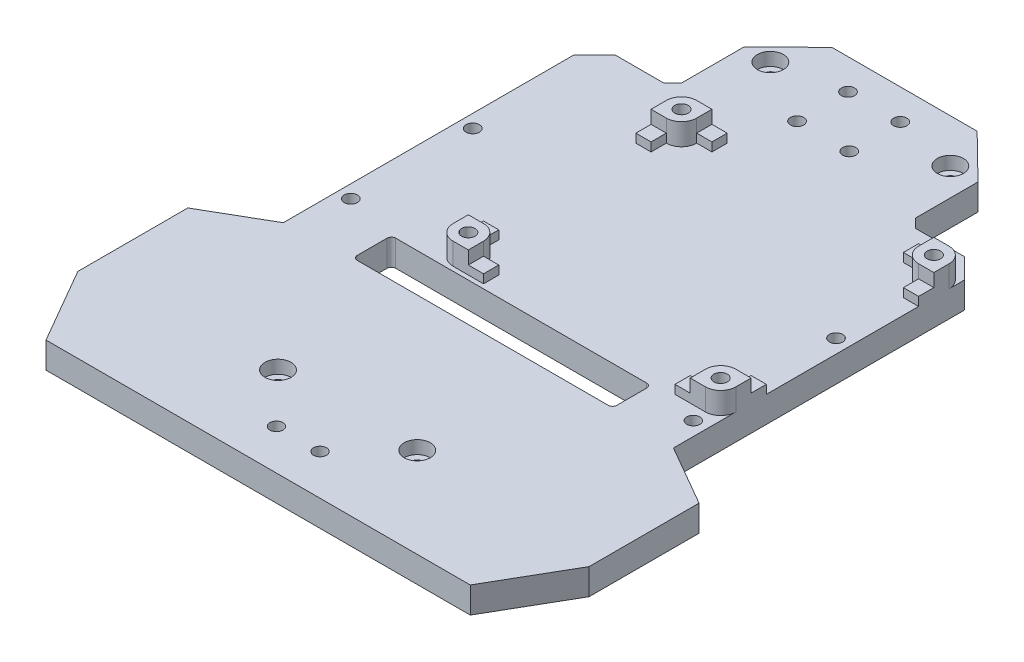
from build123d import *

# Parameters (mm, degrees)
BOSS_EXTRUDE1_DEPTH     = 6
SKETCH2_R               = 1.525
CUT_EXTRUDE1_DEPTH      = 7
SKETCH3_R               = 3
CUT_EXTRUDE2_DEPTH      = 3
SKETCH4_W               = 65
SKETCH4_H               = 56
SKETCH4_R               = 1.55
BOSS_EXTRUDE3_DEPTH     = 2
FILLET1_R               = 3.5
CUT_EXTRUDE3_DEPTH      = 100.052214883
CUT_EXTRUDE3_DEPTH_BACK = 100.052214883
SKETCH5_W               = 35
SKETCH5_H               = 2
CUT_EXTRUDE4_DEPTH      = 88.043057368
CUT_EXTRUDE4_DEPTH_BACK = 88.043057368
SKETCH4_2_R             = 1.55
CUT_EXTRUDE5_DEPTH      = 99.337435643
CUT_EXTRUDE5_DEPTH_BACK = 99.337435643
SKETCH6_W               = 44
SKETCH6_H               = 2
SKETCH8_R               = 1.55
BOSS_EXTRUDE4_DEPTH     = 3
SKETCH9_R               = 1.525
CUT_EXTRUDE6_DEPTH      = 10
SKETCH10_R              = 1.525
SKETCH10_R_2            = 1.5
CUT_EXTRUDE7_DEPTH      = 88.043057368
SKETCH11_R              = 1.5
CUT_EXTRUDE8_DEPTH      = 88.043057368
BOSS_EXTRUDE5_DEPTH     = 6
CHAMFER1_SIZE           = 10
CHAMFER1_SIZE2          = 17.320508076
CHAMFER2_SIZE           = 10
CHAMFER2_SIZE_2         = 17.320508076
SKETCH13_W              = 59.682055882
SKETCH13_H              = 8.847332747
CUT_EXTRUDE9_DEPTH      = 95.976880568
FILLET2_R               = 1


with BuildPart() as part:
    # Sketch1 → Boss-Extrude1 (new body)
    with BuildSketch(Plane(origin=(0, 0, 0), x_dir=(1, 0, 0), z_dir=(0, 1, 0))):
        Polygon((-16.600550214, 74.267677554), (-26.800550214, 64.267542947), (-26.800550214, 54.267542947), (-26.800550214, 49.870959834), (-28.827161805, 47.844348244), (-40.071838845, 47.844348244), (-44.758202946, 43.157984143), (-44.758202946, 18.06842534), (-44.758202946, -12.842015857), (-44.758202946, -32.251429112), (-40.117175005, -36.892457053), (-40.117175005, -74.312457053), (0.082824995, -74.312457053), (40.282824995, -74.312457053), (40.282824995, -36.892457053), (44.923852936, -32.251429112), (44.923852936, -12.842015857), (44.923852936, 18.06842534), (44.923852936, 43.157984143), (40.237488836, 47.844348244), (28.992811796, 47.844348244), (26.966200205, 49.870959834), (26.966200205, 54.267542947), (26.966200205, 64.267542947), (16.766200205, 74.267677554), (0.082824995, 74.267677554), align=None)
    extrude(amount=BOSS_EXTRUDE1_DEPTH)

    # Sketch2 → Cut-Extrude1 (cut)
    with BuildSketch(Plane(origin=(0, 6, 0), x_dir=(1, 0, 0), z_dir=(0, 1, 0))):
        with Locations(Location((-20.760550214, 64.267542947, 0), (0, 0, 270))):
            Circle(SKETCH2_R)
        with Locations(Location((20.606200205, 64.267542947, 0), (0, 0, 270))):
            Circle(SKETCH2_R)
        with Locations(Location((-16.077175005, -53.582457053, 0), (0, 0, 270))):
            Circle(SKETCH2_R)
        with Locations(Location((15.922824995, -53.582457053, 0), (0, 0, 270))):
            Circle(SKETCH2_R)
    extrude(amount=-CUT_EXTRUDE1_DEPTH, mode=Mode.SUBTRACT)

    # Sketch3 → Cut-Extrude2 (cut)
    with BuildSketch(Plane(origin=(0, 6, 0), x_dir=(1, 0, 0), z_dir=(0, 1, 0))):
        with Locations(Location((-20.760550214, 64.267542947, 0), (0, 0, 270))):
            Circle(SKETCH3_R)
        with Locations(Location((20.606200205, 64.267542947, 0), (0, 0, 270))):
            Circle(SKETCH3_R)
        with Locations(Location((-16.077175005, -53.582457053, 0), (0, 0, 270))):
            Circle(SKETCH3_R)
        with Locations(Location((15.922824995, -53.582457053, 0), (0, 0, 270))):
            Circle(SKETCH3_R)
    extrude(amount=-CUT_EXTRUDE2_DEPTH, mode=Mode.SUBTRACT)

    # Sketch4 → Boss-Extrude3 (add)
    with BuildSketch(Plane(origin=(0, 6, 0), x_dir=(1, 0, 0), z_dir=(0, 1, 0))):
        with Locations((12.423852936, 15.157984143)):
            Rectangle(SKETCH4_W, SKETCH4_H)
        with Locations(Location((-16.576147064, 39.657984143, 0), (0, 0, 270))):
            Circle(SKETCH4_R, mode=Mode.SUBTRACT)
        with Locations(Location((41.423852936, 39.657984143, 0), (0, 0, 270))):
            Circle(SKETCH4_R, mode=Mode.SUBTRACT)
        with Locations(Location((41.423852936, -9.342015857, 0), (0, 0, 270))):
            Circle(SKETCH4_R, mode=Mode.SUBTRACT)
        with Locations(Location((-16.576147064, -9.342015857, 0), (0, 0, 270))):
            Circle(SKETCH4_R, mode=Mode.SUBTRACT)
        with BuildLine():
            Line((41.423852936, 36.157984143), (41.423852936, -5.842015857))
            ThreePointArc((41.423852936, -5.842015857), (38.948979202, -6.867142122), (37.923852936, -9.342015857))
            Line((37.923852936, -9.342015857), (-13.076147064, -9.342015857))
            ThreePointArc((-13.076147064, -9.342015857), (-14.101273329, -6.867142122), (-16.576147064, -5.842015857))
            Line((-16.576147064, -5.842015857), (-16.576147064, 36.157984143))
            ThreePointArc((-16.576147064, 36.157984143), (-14.101273329, 37.183110409), (-13.076147064, 39.657984143))
            Line((-13.076147064, 39.657984143), (37.923852936, 39.657984143))
            ThreePointArc((37.923852936, 39.657984143), (38.948979202, 37.183110409), (41.423852936, 36.157984143))
        make_face(mode=Mode.SUBTRACT)
    extrude(amount=BOSS_EXTRUDE3_DEPTH)

    # Fillet1
    fillet1_edges = [part.edges().sort_by_distance(p)[0] for p in [
        (-20.076147064, 7, -43.157984143),
        (-20.076147064, 7, 12.842015857),
        (44.923852936, 7, 12.842015857),
        (44.923852936, 7, -43.157984143),
    ]]
    fillet(fillet1_edges, radius=FILLET1_R)

    # Sketch5 → Cut-Extrude3 (cut, two sides: drawn at the far end of the back side and taken through both)
    with BuildSketch(Plane.ZY.offset(20.076147064).offset(-CUT_EXTRUDE3_DEPTH_BACK)):
        with Locations((-15.157984143, 7)):
            Rectangle(SKETCH5_W, SKETCH5_H)
    extrude(amount=CUT_EXTRUDE3_DEPTH + CUT_EXTRUDE3_DEPTH_BACK, mode=Mode.SUBTRACT)

    # Sketch4<2> → Cut-Extrude4 (cut, two sides: drawn at the far end of the back side and taken through both)
    with BuildSketch(Plane(origin=(0, 6, 0), x_dir=(1, 0, 0), z_dir=(0, 1, 0)).offset(-CUT_EXTRUDE4_DEPTH_BACK)):
        with Locations(Location((-16.576147064, 39.657984143, 0), (0, 0, 270))):
            Circle(SKETCH4_2_R)
        with Locations(Location((41.423852936, 39.657984143, 0), (0, 0, 270))):
            Circle(SKETCH4_2_R)
        with Locations(Location((41.423852936, -9.342015857, 0), (0, 0, 270))):
            Circle(SKETCH4_2_R)
        with Locations(Location((-16.576147064, -9.342015857, 0), (0, 0, 270))):
            Circle(SKETCH4_2_R)
    extrude(amount=CUT_EXTRUDE4_DEPTH + CUT_EXTRUDE4_DEPTH_BACK, mode=Mode.SUBTRACT)

    # Sketch6 → Cut-Extrude5 (cut, two sides: drawn at the far end of the back side and taken through both)
    with BuildSketch(Plane.XY.offset(12.842015857).offset(-CUT_EXTRUDE5_DEPTH_BACK)):
        with Locations((12.423852936, 7)):
            Rectangle(SKETCH6_W, SKETCH6_H)
    extrude(amount=CUT_EXTRUDE5_DEPTH + CUT_EXTRUDE5_DEPTH_BACK, mode=Mode.SUBTRACT)

    # Sketch8 → Boss-Extrude4 (add)
    # profile 1 of 4: a face of its own
    with BuildSketch(Plane(origin=(0, 8, 0), x_dir=(1, 0, 0), z_dir=(0, 1, 0))):
        with BuildLine():
            Line((-13.076147064, -9.342015857), (-13.076147064, -12.842015857))
            Line((-13.076147064, -12.842015857), (-16.576147064, -12.842015857))
            ThreePointArc((-16.576147064, -12.842015857), (-19.051020798, -11.816889591), (-20.076147064, -9.342015857))
            Line((-20.076147064, -9.342015857), (-20.076147064, -5.842015857))
            Line((-20.076147064, -5.842015857), (-16.576147064, -5.842015857))
            ThreePointArc((-16.576147064, -5.842015857), (-14.101273329, -6.867142122), (-13.076147064, -9.342015857))
        make_face()
        with Locations(Location((-16.576147064, -9.342015857, 0), (0, 0, 270))):
            Circle(SKETCH8_R, mode=Mode.SUBTRACT)
    # profile 2 of 4: a face of its own
    with BuildSketch(Plane(origin=(0, 8, 0), x_dir=(1, 0, 0), z_dir=(0, 1, 0))):
        with BuildLine():
            Line((41.423852936, -12.842015857), (37.923852936, -12.842015857))
            Line((37.923852936, -12.842015857), (37.923852936, -9.342015857))
            ThreePointArc((37.923852936, -9.342015857), (38.948979202, -6.867142122), (41.423852936, -5.842015857))
            Line((41.423852936, -5.842015857), (44.923852936, -5.842015857))
            Line((44.923852936, -5.842015857), (44.923852936, -9.342015857))
            ThreePointArc((44.923852936, -9.342015857), (43.898726671, -11.816889591), (41.423852936, -12.842015857))
        make_face()
        with Locations(Location((41.423852936, -9.342015857, 0), (0, 0, 270))):
            Circle(SKETCH8_R, mode=Mode.SUBTRACT)
    # profile 3 of 4: a face of its own
    with BuildSketch(Plane(origin=(0, 8, 0), x_dir=(1, 0, 0), z_dir=(0, 1, 0))):
        with BuildLine():
            Line((-16.576147064, 43.157984143), (-13.076147064, 43.157984143))
            Line((-13.076147064, 43.157984143), (-13.076147064, 39.657984143))
            ThreePointArc((-13.076147064, 39.657984143), (-14.101273329, 37.183110409), (-16.576147064, 36.157984143))
            Line((-16.576147064, 36.157984143), (-20.076147064, 36.157984143))
            Line((-20.076147064, 36.157984143), (-20.076147064, 39.657984143))
            ThreePointArc((-20.076147064, 39.657984143), (-19.051020798, 42.132857878), (-16.576147064, 43.157984143))
        make_face()
        with Locations(Location((-16.576147064, 39.657984143, 0), (0, 0, 270))):
            Circle(SKETCH8_R, mode=Mode.SUBTRACT)
    # profile 4 of 4: a face of its own
    with BuildSketch(Plane(origin=(0, 8, 0), x_dir=(1, 0, 0), z_dir=(0, 1, 0))):
        with BuildLine():
            Line((37.923852936, 39.657984143), (37.923852936, 43.157984143))
            Line((37.923852936, 43.157984143), (41.423852936, 43.157984143))
            ThreePointArc((41.423852936, 43.157984143), (43.898726671, 42.132857878), (44.923852936, 39.657984143))
            Line((44.923852936, 39.657984143), (44.923852936, 36.157984143))
            Line((44.923852936, 36.157984143), (41.423852936, 36.157984143))
            ThreePointArc((41.423852936, 36.157984143), (38.948979202, 37.183110409), (37.923852936, 39.657984143))
        make_face()
        with Locations(Location((41.423852936, 39.657984143, 0), (0, 0, 270))):
            Circle(SKETCH8_R, mode=Mode.SUBTRACT)
    extrude(amount=BOSS_EXTRUDE4_DEPTH)

    # Sketch9 → Cut-Extrude6 (cut)
    with BuildSketch(Plane(origin=(0, 6, 0), x_dir=(1, 0, 0), z_dir=(0, 1, 0))):
        with Locations(Location((-5.917175005, 67.267677554, 0), (0, 0, 270))):
            Circle(SKETCH9_R)
        with Locations(Location((6.082824995, 67.267677554, 0), (0, 0, 270))):
            Circle(SKETCH9_R)
        with Locations(Location((-5.917175005, 55.557677554, 0), (0, 0, 270))):
            Circle(SKETCH9_R)
        with Locations(Location((6.082824995, 55.557677554, 0), (0, 0, 270))):
            Circle(SKETCH9_R)
    extrude(amount=-CUT_EXTRUDE6_DEPTH, mode=Mode.SUBTRACT)

    # Sketch10 → Cut-Extrude7 (cut, through all)
    with BuildSketch(Plane(origin=(0, 6, 0), x_dir=(1, 0, 0), z_dir=(0, 1, 0))):
        with Locations(Location((-41.758202946, -11.157457053, 0), (0, 0, 270))):
            Circle(SKETCH10_R)
        with Locations(Location((-41.758202946, 16.842542947, 0), (0, 0, 90))):
            Circle(SKETCH10_R)
        with Locations(Location((41.758202946, 16.842542947, 0), (0, 0, 270))):
            Circle(SKETCH10_R)
        with Locations(Location((41.758202946, -15.957457053, 0), (0, 0, 270))):
            Circle(SKETCH10_R_2)
    extrude(amount=-CUT_EXTRUDE7_DEPTH, mode=Mode.SUBTRACT)

    # Sketch11 → Cut-Extrude8 (cut, through all)
    with BuildSketch(Plane(origin=(0, 6, 0), x_dir=(1, 0, 0), z_dir=(0, 1, 0))):
        with Locations(Location((-5, -65.012457053, 0), (0, 0, 270))):
            Circle(SKETCH11_R)
        with Locations(Location((5, -65.012457053, 0), (0, 0, 90))):
            Circle(SKETCH11_R)
    extrude(amount=-CUT_EXTRUDE8_DEPTH, mode=Mode.SUBTRACT)

    # Sketch12 → Boss-Extrude5 (add, through all)
    with BuildSketch(Plane(origin=(0, 6, 0), x_dir=(1, 0, 0), z_dir=(0, 1, 0))):
        Polygon((58.841027941, -21.72443334), (44.923852936, -21.72443334), (44.923852936, -32.251429112), (40.282824995, -36.892457053), (40.282824995, -74.312457053), (58.841027941, -74.312457053), align=None)
        Polygon((-44.758202946, -32.251429112), (-44.758202946, -21.72443334), (-58.67537795, -21.72443334), (-58.67537795, -74.312457053), (-40.117175005, -74.312457053), (-40.117175005, -36.892457053), align=None)
    extrude(amount=-BOSS_EXTRUDE5_DEPTH)

    # Chamfer1
    chamfer1_edges = [part.edges().sort_by_distance(p)[0] for p in [
        (58.841027941, 3, 74.312457053),
        (-58.67537795, 3, 74.312457053),
    ]]
    chamfer1_side = [part.faces().sort_by_distance(p)[0] for p in [
        (0.082824995, 3, 74.312457053),
    ]]
    chamfer(chamfer1_edges, length=CHAMFER1_SIZE, length2=CHAMFER1_SIZE2, reference=chamfer1_side[0])

    # Chamfer2
    # the kernel refuses this chamfer: 17.320508076, 10 mm, written as the material it takes off along each edge
    with BuildSketch(Plane(origin=(58.841027941, 50.809639706, 21.72443334), x_dir=(0.05789386240267111, 0, 0.9983227437537926), z_dir=(0, -1, 0))) as chamfer2_piece_1_section:
        Polygon((CHAMFER2_SIZE * 0.998322743754, CHAMFER2_SIZE * 0.0578938624027), (-CHAMFER2_SIZE_2 * 0.0578938624016, CHAMFER2_SIZE_2 * 0.998322743736), (0, 0), align=None)
    chamfer2_piece_1 = extrude(amount=95.619279412, mode=Mode.PRIVATE)
    chamfer2_piece_1 = split(chamfer2_piece_1, bisect_by=Plane(origin=(44.923852936, 3, 25.108409846), z_dir=(1, 0, 0)), keep=Keep.TOP, mode=Mode.PRIVATE)
    add(chamfer2_piece_1, mode=Mode.SUBTRACT)
    with BuildSketch(Plane(origin=(-58.67537795, 50.809639706, 21.72443334), x_dir=(-0.05789386240267113, 0, 0.9983227437537926), z_dir=(0, -1, 0))) as chamfer2_piece_2_section:
        Polygon((CHAMFER2_SIZE * 0.998322743754, -CHAMFER2_SIZE * 0.0578938624027), (-CHAMFER2_SIZE_2 * 0.0578938624016, -CHAMFER2_SIZE_2 * 0.998322743736), (0, 0), align=None)
    chamfer2_piece_2 = extrude(amount=95.619279412, mode=Mode.PRIVATE)
    chamfer2_piece_2 = split(chamfer2_piece_2, bisect_by=Plane(origin=(-44.758202946, 3, 25.108409846), z_dir=(-1, 0, 0)), keep=Keep.TOP, mode=Mode.PRIVATE)
    add(chamfer2_piece_2, mode=Mode.SUBTRACT)

    # Sketch13 → Cut-Extrude9 (cut, through all)
    with BuildSketch(Plane(origin=(0, 6, 0), x_dir=(1, 0, 0), z_dir=(0, 1, 0))):
        with Locations((0.082824995, -18.265682231)):
            Rectangle(SKETCH13_W, SKETCH13_H)
    extrude(amount=-CUT_EXTRUDE9_DEPTH, mode=Mode.SUBTRACT)

    # Fillet2
    fillet2_edges = [part.edges().sort_by_distance(p)[0] for p in [
        (-29.758202946, 3, 22.689348604),
        (-29.758202946, 3, 13.842015857),
        (29.923852936, 3, 13.842015857),
        (29.923852936, 3, 22.689348604),
    ]]
    fillet(fillet2_edges, radius=FILLET2_R)


solid = part.part
